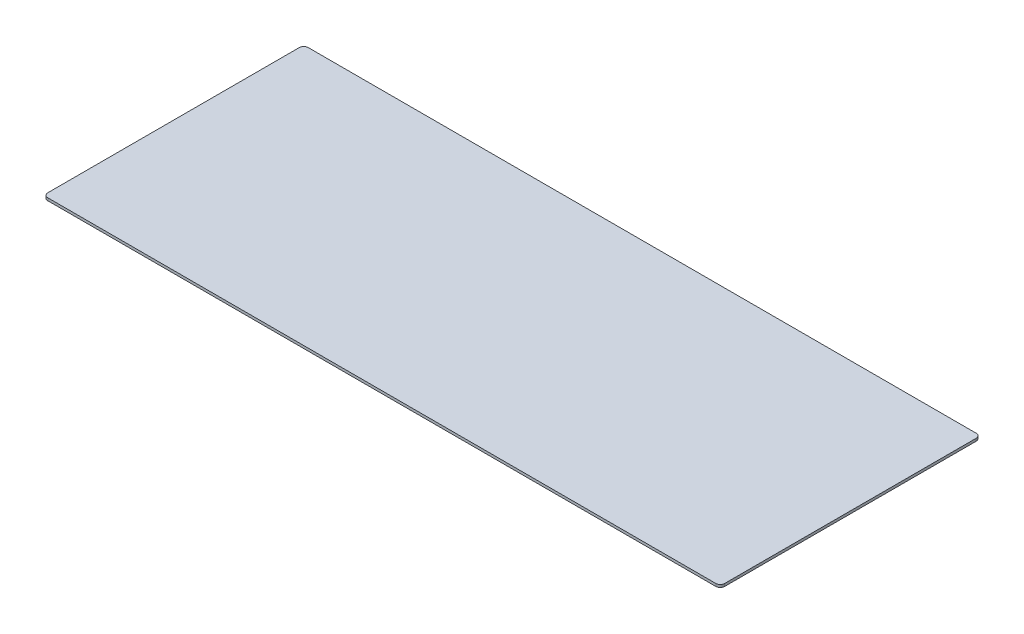
from build123d import *

# Parameters (mm, degrees)
SKETCH2_W           = 780
SKETCH2_H           = 300
BOSS_EXTRUDE1_DEPTH = 3
FILLET1_R           = 5


with BuildPart() as part:
    # Sketch2 → Boss-Extrude1 (new body)
    with BuildSketch(Plane(origin=(0, 0, 0), x_dir=(1, 0, 0), z_dir=(0, 1, 0))):
        Rectangle(SKETCH2_W, SKETCH2_H)
    extrude(amount=BOSS_EXTRUDE1_DEPTH)

    # Fillet1
    fillet1_edges = [part.edges().sort_by_distance(p)[0] for p in [
        (390, 1.5, -150),
        (390, 1.5, 150),
        (-390, 1.5, 150),
        (-390, 1.5, -150),
    ]]
    fillet(fillet1_edges, radius=FILLET1_R)


solid = part.part
